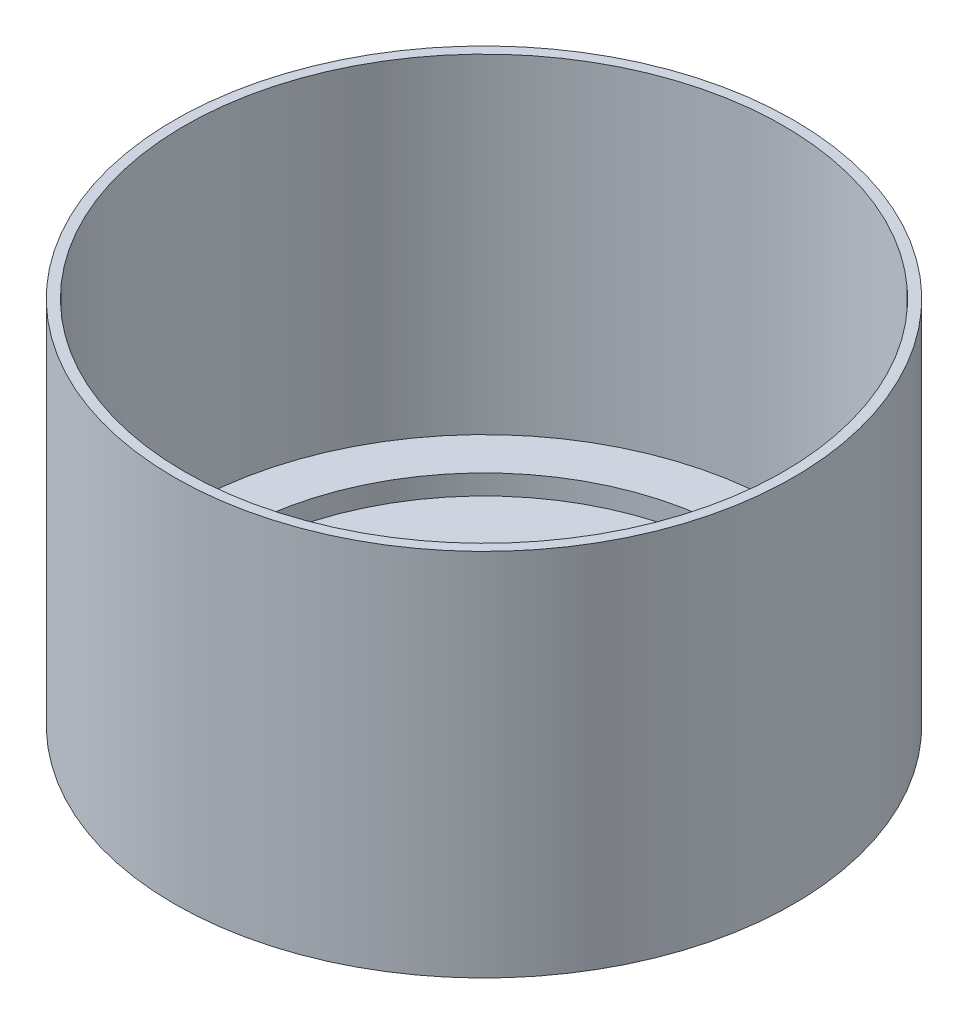
from build123d import *

# Parameters (mm, degrees)
SKETCH1_R           = 31
SKETCH1_R_2         = 30
BOSS_EXTRUDE1_DEPTH = 37
SKETCH2_R           = 31
BOSS_EXTRUDE2_DEPTH = 2
SKETCH5_R           = 30
SKETCH5_R_2         = 25.3
BOSS_EXTRUDE4_DEPTH = 2
SKETCH6_R           = 4
CUT_EXTRUDE1_DEPTH  = 2


with BuildPart() as part:
    # Sketch1 → Boss-Extrude1 (new body)
    with BuildSketch(Plane(origin=(0, 0, 0), x_dir=(1, 0, 0), z_dir=(0, 1, 0))):
        Circle(SKETCH1_R)
        Circle(SKETCH1_R_2, mode=Mode.SUBTRACT)
    extrude(amount=BOSS_EXTRUDE1_DEPTH)

    # Sketch2 → Boss-Extrude2 (add)
    with BuildSketch(Plane(origin=(0, 0, 0), x_dir=(1, 0, 0), z_dir=(0, 1, 0))):
        Circle(SKETCH2_R)
    extrude(amount=BOSS_EXTRUDE2_DEPTH)

    # Sketch5 → Boss-Extrude4 (add)
    with BuildSketch(Plane(origin=(0, 2, 0), x_dir=(1, 0, 0), z_dir=(0, 1, 0))):
        Circle(SKETCH5_R)
        Circle(SKETCH5_R_2, mode=Mode.SUBTRACT)
    extrude(amount=BOSS_EXTRUDE4_DEPTH)

    # Sketch6 → Cut-Extrude1 (cut)
    with BuildSketch(Plane(origin=(0, 2, 0), x_dir=(1, 0, 0), z_dir=(0, 1, 0))):
        Circle(SKETCH6_R)
    extrude(amount=-CUT_EXTRUDE1_DEPTH, mode=Mode.SUBTRACT)


solid = part.part
